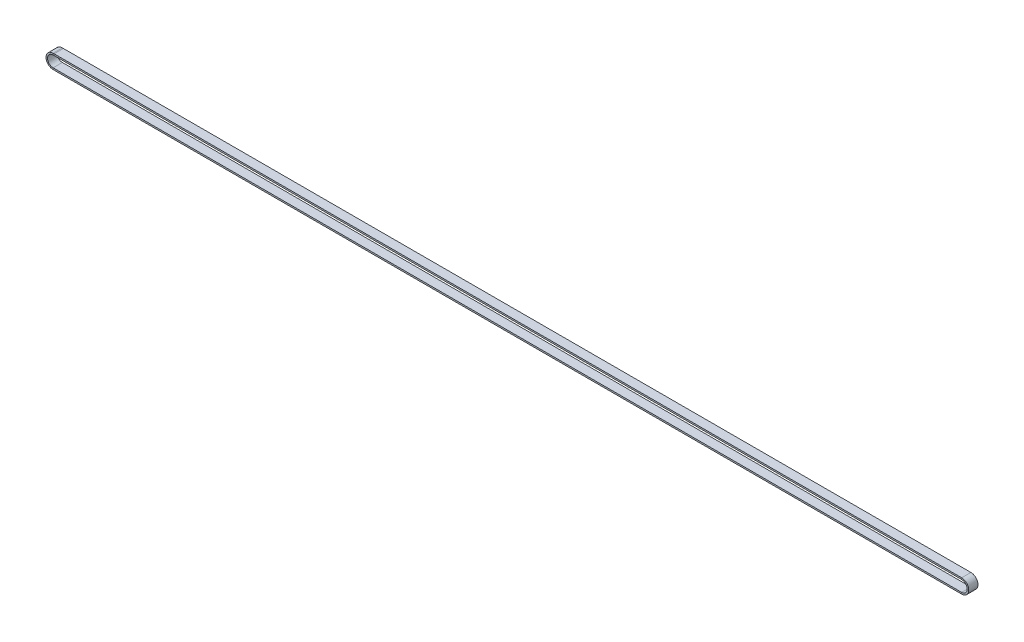
from build123d import *

# Parameters (mm, degrees)
SKETCH3_W = 9
SKETCH3_H = 1.5


with BuildPart() as part:
    # Sweep1: sweep along a path in Sketch2
    with BuildLine(Plane.XY.offset(-93.733366658)) as sweep1_path:
        Line((-1, 41.370834612), (883.520637828, 41.370834612))
        ThreePointArc((883.520637828, 41.370834612), (890.420637828, 34.470834612), (883.520637828, 27.570834612))
        Line((883.520637828, 27.570834612), (-1, 27.570834612))
        ThreePointArc((-1, 27.570834612), (-7.9, 34.470834612), (-1, 41.370834612))
    # Sketch3 → Sweep1 (sweep)
    with BuildSketch(Plane(origin=(0, 0, 0), x_dir=(0, 0, -1), z_dir=(1, 0, 0))):
        with Locations((89.233366658, 40.620834612)):
            Rectangle(SKETCH3_W, SKETCH3_H)
    sweep(path=sweep1_path.line)


solid = part.part
